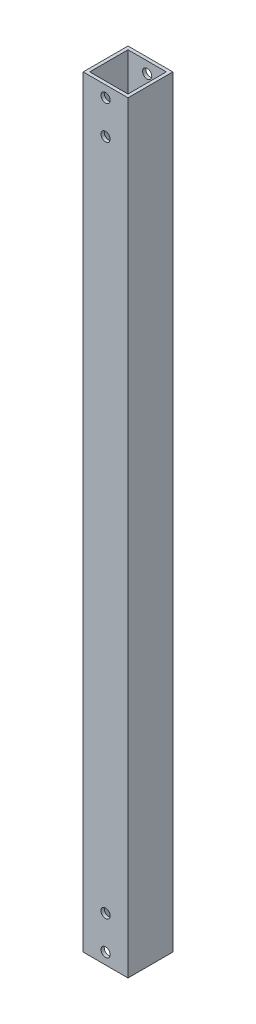
from build123d import *

# Parameters (mm, degrees)
SKETCH1_W           = 20
SKETCH1_H           = 20
SKETCH1_W_2         = 17.1
SKETCH1_H_2         = 17.1
BOSS_EXTRUDE1_DEPTH = 340
SKETCH2_R           = 2.05
CUT_EXTRUDE1_DEPTH  = 342.174442185


with BuildPart() as part:
    # Sketch1 → Boss-Extrude1 (new body)
    with BuildSketch(Plane(origin=(0, 0, 0), x_dir=(1, 0, 0), z_dir=(0, 1, 0))):
        with Locations((10, 10)):
            Rectangle(SKETCH1_W, SKETCH1_H)
        with Locations((10, 10)):
            Rectangle(SKETCH1_W_2, SKETCH1_H_2, mode=Mode.SUBTRACT)
    extrude(amount=BOSS_EXTRUDE1_DEPTH)

    # Sketch2 → Cut-Extrude1 (cut, through all)
    with BuildSketch(Plane(origin=(0, 0, -20), x_dir=(-1, 0, 0), z_dir=(0, 0, -1))):
        with Locations((-10, 335)):
            Circle(SKETCH2_R)
        with Locations((-10, 320)):
            Circle(SKETCH2_R)
        with Locations((-10, 20)):
            Circle(SKETCH2_R)
        with Locations((-10, 5)):
            Circle(SKETCH2_R)
    extrude(amount=-CUT_EXTRUDE1_DEPTH, mode=Mode.SUBTRACT)


solid = part.part
